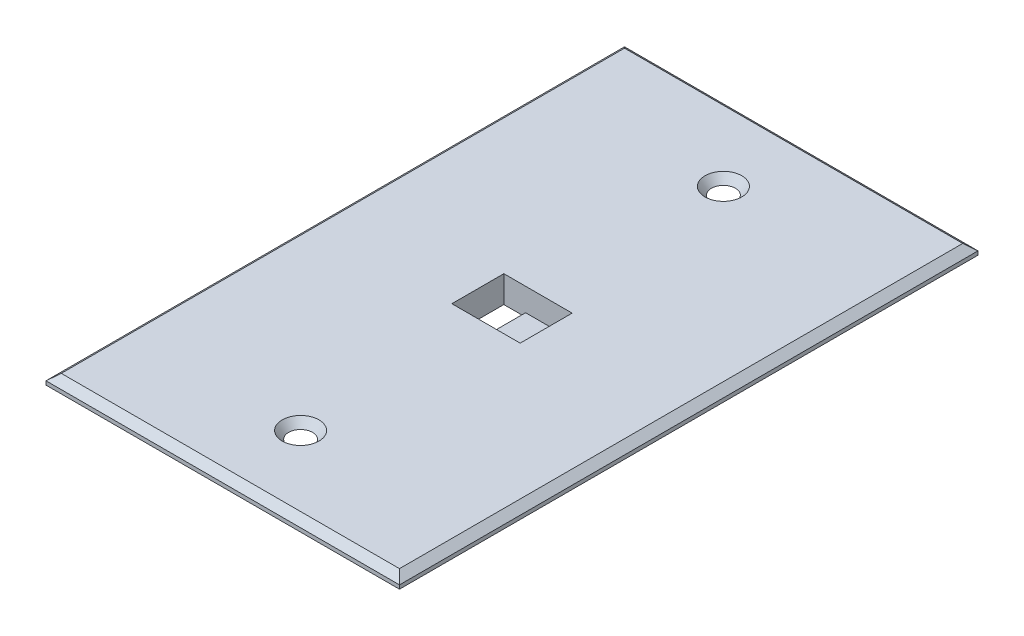
from build123d import *
from OCP.BRepFilletAPI import BRepFilletAPI_MakeChamfer

# Parameters (mm, degrees)
SKETCH1_W            = 69.35
SKETCH1_H            = 113.5
BOSS_EXTRUDE5_DEPTH  = 2
SKETCH2_R            = 2.35
CUT_EXTRUDE3_DEPTH   = 2.5
FACE_CHAMFER_SIZE    = 1.5
FACE_CHAMFER_SIZE2   = 1.258649447
SKETCH4_W            = 60.238416088
SKETCH4_H            = 90.514495008
CUT_EXTRUDE6_DEPTH   = 0.5
SKETCH5_W            = 20.93325514
SKETCH5_H            = 17.0989254
SKETCH5_W_2          = 13.4
SKETCH5_H_2          = 10.2
BOSS_EXTRUDE7_DEPTH  = 4.5
SKETCH6_W            = 13.4
SKETCH6_H            = 10.2
CUT_EXTRUDE7_DEPTH   = 4.1
SKETCH7_W            = 20.93325514
SKETCH7_H            = 17.0989254
BOSS_EXTRUDE8_DEPTH  = 0.75
SKETCH8_W            = 2.621357244
SKETCH8_H            = 10.2
CUT_EXTRUDE8_DEPTH   = 0.5
SKETCH10_W           = 1.18316995
SKETCH10_H           = 0.660821766
BOSS_EXTRUDE11_DEPTH = 1
FILLET1_R            = 0.9
SKETCH11_W           = 4.263170706
SKETCH11_H           = 10.2
CUT_EXTRUDE9_DEPTH   = 10


with BuildPart() as part:
    # Sketch1 → Boss-Extrude5 (new body)
    with BuildSketch(Plane(origin=(0, 0, 0), x_dir=(1, 0, 0), z_dir=(0, 1, 0))):
        Rectangle(SKETCH1_W, SKETCH1_H)
    extrude(amount=BOSS_EXTRUDE5_DEPTH)

    # Sketch2 → Cut-Extrude3 (cut)
    with BuildSketch(Plane(origin=(0, 2, 0), x_dir=(1, 0, 0), z_dir=(0, 1, 0))):
        with Locations(Location((0, 41.476002696, 0), (0, 0, 270))):
            Circle(SKETCH2_R)
        with Locations(Location((0, -41.476002696, 0), (0, 0, 90))):
            Circle(SKETCH2_R)
    extrude(amount=-CUT_EXTRUDE3_DEPTH, mode=Mode.SUBTRACT)

    # face chamfer: one chamfer whose edges measure the first distance from different faces: ONE call of the kernel's chamfer builder (chamfer() names one face for all edges)
    face_chamfer_edges_1 = [part.edges().sort_by_distance(p)[0] for p in [
        (0, 2, -56.75),
        (-34.675, 2, 0),
        (0, 2, 56.75),
        (34.675, 2, 0),
    ]]
    face_chamfer_side_1 = [part.faces().sort_by_distance(p)[0] for p in [
        (0, 2, 0),
    ]]
    face_chamfer_edges_2 = [part.edges().sort_by_distance(p)[0] for p in [
        (0, 2, -43.826002696),
    ]]
    face_chamfer_side_2 = [part.faces().sort_by_distance(p)[0] for p in [
        (0, 1, -43.826002696),
    ]]
    face_chamfer_edges_3 = [part.edges().sort_by_distance(p)[0] for p in [
        (0, 2, 43.826002696),
    ]]
    face_chamfer_side_3 = [part.faces().sort_by_distance(p)[0] for p in [
        (0, 1, 43.826002696),
    ]]
    face_chamfer = BRepFilletAPI_MakeChamfer(part.part.solid().wrapped)
    for e in face_chamfer_edges_1:
        face_chamfer.Add(FACE_CHAMFER_SIZE, FACE_CHAMFER_SIZE2, e.wrapped, face_chamfer_side_1[0].wrapped)  # the first distance lies on this face
    for e in face_chamfer_edges_2:
        face_chamfer.Add(FACE_CHAMFER_SIZE, FACE_CHAMFER_SIZE2, e.wrapped, face_chamfer_side_2[0].wrapped)  # the first distance lies on this face
    for e in face_chamfer_edges_3:
        face_chamfer.Add(FACE_CHAMFER_SIZE, FACE_CHAMFER_SIZE2, e.wrapped, face_chamfer_side_3[0].wrapped)  # the first distance lies on this face
    add(Compound.cast(face_chamfer.Shape()), mode=Mode.REPLACE)

    # Sketch4 → Cut-Extrude6 (cut)
    with BuildSketch(Plane(origin=(0, 0, 0), x_dir=(-1, 0, 0), z_dir=(0, -1, 0))):
        Rectangle(SKETCH4_W, SKETCH4_H)
    extrude(amount=-CUT_EXTRUDE6_DEPTH, mode=Mode.SUBTRACT)

    # Sketch5 → Boss-Extrude7 (add)
    with BuildSketch(Plane(origin=(0, 2, 0), x_dir=(1, 0, 0), z_dir=(0, 1, 0))):
        Rectangle(SKETCH5_W, SKETCH5_H)
        Rectangle(SKETCH5_W_2, SKETCH5_H_2, mode=Mode.SUBTRACT)
    extrude(amount=-BOSS_EXTRUDE7_DEPTH)

    # Sketch6 → Cut-Extrude7 (cut)
    with BuildSketch(Plane(origin=(0, 2, 0), x_dir=(1, 0, 0), z_dir=(0, 1, 0))):
        Rectangle(SKETCH6_W, SKETCH6_H)
    extrude(amount=-CUT_EXTRUDE7_DEPTH, mode=Mode.SUBTRACT)

    # Sketch7 → Boss-Extrude8 (add)
    with BuildSketch(Plane.XZ.offset(2.5)):
        Rectangle(SKETCH7_W, SKETCH7_H)
    extrude(amount=BOSS_EXTRUDE8_DEPTH)

    # Sketch8 → Cut-Extrude8 (cut)
    with BuildSketch(Plane(origin=(0, -2.5, 0), x_dir=(1, 0, 0), z_dir=(0, 1, 0))):
        with Locations((-5.389321378, 0)):
            Rectangle(SKETCH8_W, SKETCH8_H)
    extrude(amount=-CUT_EXTRUDE8_DEPTH, mode=Mode.SUBTRACT)

    # Sketch10 → Boss-Extrude11 (add)
    with BuildSketch(Plane.ZY.offset(-6.7)):
        with Locations((-0.045919003, 0.630410883)):
            Rectangle(SKETCH10_W, SKETCH10_H)
    extrude(amount=BOSS_EXTRUDE11_DEPTH)

    # Fillet1
    # the kernel refuses this fillet: 0.9 mm, written as the material it takes off along each edge
    with BuildSketch(Plane(origin=(5.7, 0.960821766, 2.714758197), x_dir=(1, 0, 0), z_dir=(0, 0, -1))) as fillet1_piece_1:
        with BuildLine():
            CenterArc((0.86763689, 0.9), FILLET1_R, 195.411736224, 74.588263776)
            Line((0, 0.660821766), (-0.017352738, 0.656038202))
            ThreePointArc((-0.017352738, 0.656038202), (-0.018, 0.330410883), (-0.018, 0))
            Line((-0.018, 0), (0, -0.018))
            Line((0, -0.018), (0.86763689, -0.018))
            Line((0.86763689, -0.018), (0.86763689, 0))
        make_face()
    extrude(amount=5.521354399, mode=Mode.SUBTRACT)

    # Sketch11 → Cut-Extrude9 (cut)
    with BuildSketch(Plane(origin=(0, -3.25, 0), x_dir=(-1, 0, 0), z_dir=(0, -1, 0))):
        with Locations((4.568414647, 0)):
            Rectangle(SKETCH11_W, SKETCH11_H)
    extrude(amount=-CUT_EXTRUDE9_DEPTH, mode=Mode.SUBTRACT)


solid = part.part
